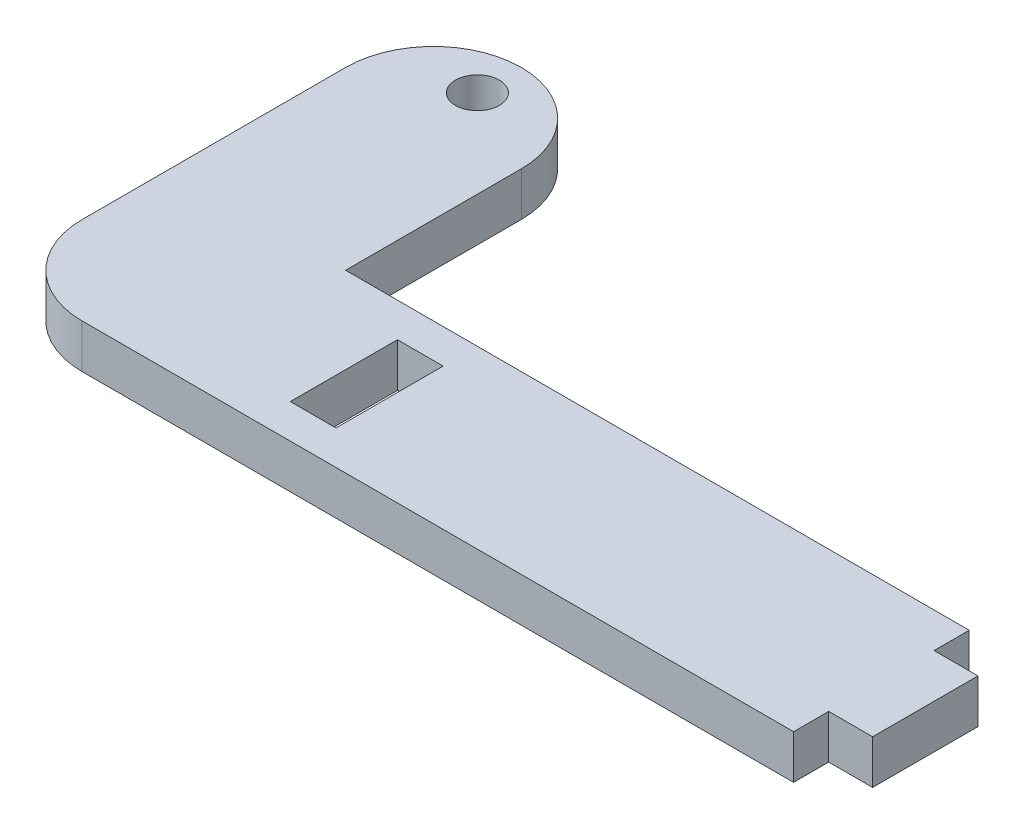
from build123d import *

# Parameters (mm, degrees)
SKETCH1_R           = 1.5875
SKETCH1_W           = 3.302
SKETCH1_H           = 7.747
BOSS_EXTRUDE1_DEPTH = 3.175
SKETCH3_W           = 3.175
SKETCH3_H           = 2.54
CUT_EXTRUDE1_DEPTH  = 3.175
FILLET1_R           = 6.35
FILLET2_R           = 6.35
FILLET3_R           = 6.35


with BuildPart() as part:
    # Sketch1 → Boss-Extrude1 (new body)
    with BuildSketch(Plane(origin=(0, 0, 0), x_dir=(1, 0, 0), z_dir=(0, 1, 0))):
        Polygon((30.48, 6.35), (-17.78, 6.35), (-17.78, 25.4), (-30.48, 25.4), (-30.48, 6.35), (-30.48, -6.35), (30.48, -6.35), align=None)
        with Locations(Location((-24.13, 22.225, 0), (0, 0, 270))):
            Circle(SKETCH1_R, mode=Mode.SUBTRACT)
        with Locations((-9.906, 0)):
            Rectangle(SKETCH1_W, SKETCH1_H, mode=Mode.SUBTRACT)
    extrude(amount=BOSS_EXTRUDE1_DEPTH)

    # Sketch3 → Cut-Extrude1 (cut)
    with BuildSketch(Plane(origin=(0, 3.175, 0), x_dir=(1, 0, 0), z_dir=(0, 1, 0))):
        with Locations((28.8925, 5.08)):
            Rectangle(SKETCH3_W, SKETCH3_H)
        with Locations((28.8925, -5.08)):
            Rectangle(SKETCH3_W, SKETCH3_H)
    extrude(amount=-CUT_EXTRUDE1_DEPTH, mode=Mode.SUBTRACT)

    # Fillet1
    fillet1_edges = [part.edges().sort_by_distance(p)[0] for p in [
        (-30.48, 1.5875, -25.4),
    ]]
    fillet(fillet1_edges, radius=FILLET1_R)

    # Fillet2
    fillet2_edges = [part.edges().sort_by_distance(p)[0] for p in [
        (-17.78, 1.5875, -25.4),
    ]]
    fillet(fillet2_edges, radius=FILLET2_R - 0.0001)  # a hair under: the kernel refuses the full size

    # Fillet3
    fillet3_edges = [part.edges().sort_by_distance(p)[0] for p in [
        (-30.48, 1.5875, 6.35),
    ]]
    fillet(fillet3_edges, radius=FILLET3_R)


solid = part.part
